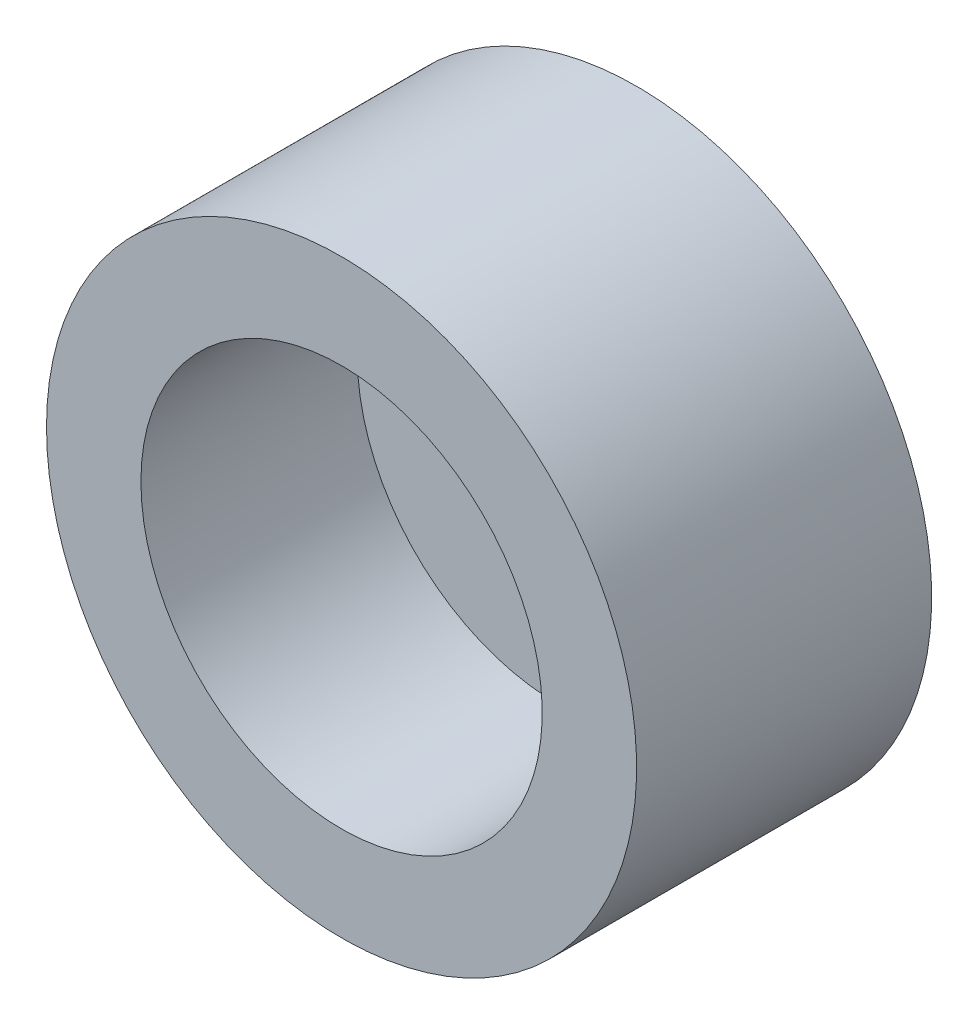
from build123d import *

# Parameters (mm, degrees)
SKETCH1_R           = 19.05
SKETCH1_R_2         = 12.954
BOSS_EXTRUDE1_DEPTH = 19.05
SKETCH1_2_R         = 12.954
BOSS_EXTRUDE2_DEPTH = 5.08


with BuildPart() as part:
    # Sketch1 → Boss-Extrude1 (new body)
    with BuildSketch(Plane.XY):
        Circle(SKETCH1_R)
        Circle(SKETCH1_R_2, mode=Mode.SUBTRACT)
    extrude(amount=BOSS_EXTRUDE1_DEPTH)

    # Sketch1<2> → Boss-Extrude2 (add)
    with BuildSketch(Plane.XY):
        Circle(SKETCH1_2_R)
    extrude(amount=BOSS_EXTRUDE2_DEPTH)


solid = part.part
